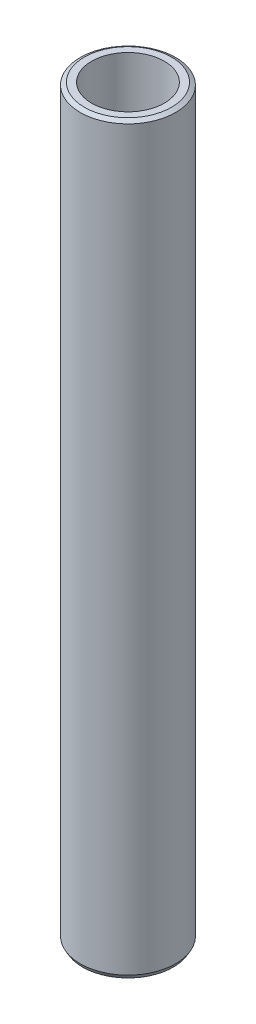
from build123d import *
from OCP.BRepFilletAPI import BRepFilletAPI_MakeChamfer

# Parameters (mm, degrees)
SKETCH1_R           = 30
BOSS_EXTRUDE1_DEPTH = 467.641612657
SKETCH2_R           = 22.871331343
CUT_EXTRUDE1_DEPTH  = 470.562219401
CHAMFER1_SIZE       = 1.512779286
CHAMFER1_SIZE2      = 2.620210585


with BuildPart() as part:
    # Sketch1 → Boss-Extrude1 (new body)
    with BuildSketch(Plane(origin=(0, 0, 0), x_dir=(1, 0, 0), z_dir=(0, 1, 0))):
        Circle(SKETCH1_R)
    extrude(amount=BOSS_EXTRUDE1_DEPTH)

    # Sketch2 → Cut-Extrude1 (cut, through all)
    with BuildSketch(Plane(origin=(0, 0, 0), x_dir=(1, 0, 0), z_dir=(0, 1, 0))):
        Circle(SKETCH2_R)
    extrude(amount=CUT_EXTRUDE1_DEPTH, mode=Mode.SUBTRACT)

    # Chamfer1: one chamfer whose edges measure the first distance from different faces: ONE call of the kernel's chamfer builder (chamfer() names one face for all edges)
    chamfer1_edges_1 = [part.edges().sort_by_distance(p)[0] for p in [
        (-30, 467.641612657, 0),
    ]]
    chamfer1_side_1 = [part.faces().sort_by_distance(p)[0] for p in [
        (-30, 233.820806329, 0),
    ]]
    chamfer1_edges_2 = [part.edges().sort_by_distance(p)[0] for p in [
        (-30, 0, 0),
    ]]
    chamfer1_side_2 = [part.faces().sort_by_distance(p)[0] for p in [
        (-29.151471863, 0, 0),
    ]]
    chamfer1 = BRepFilletAPI_MakeChamfer(part.part.solid().wrapped)
    for e in chamfer1_edges_1:
        chamfer1.Add(CHAMFER1_SIZE, CHAMFER1_SIZE2, e.wrapped, chamfer1_side_1[0].wrapped)  # the first distance lies on this face
    for e in chamfer1_edges_2:
        chamfer1.Add(CHAMFER1_SIZE, CHAMFER1_SIZE2, e.wrapped, chamfer1_side_2[0].wrapped)  # the first distance lies on this face
    add(Compound.cast(chamfer1.Shape()), mode=Mode.REPLACE)


solid = part.part
